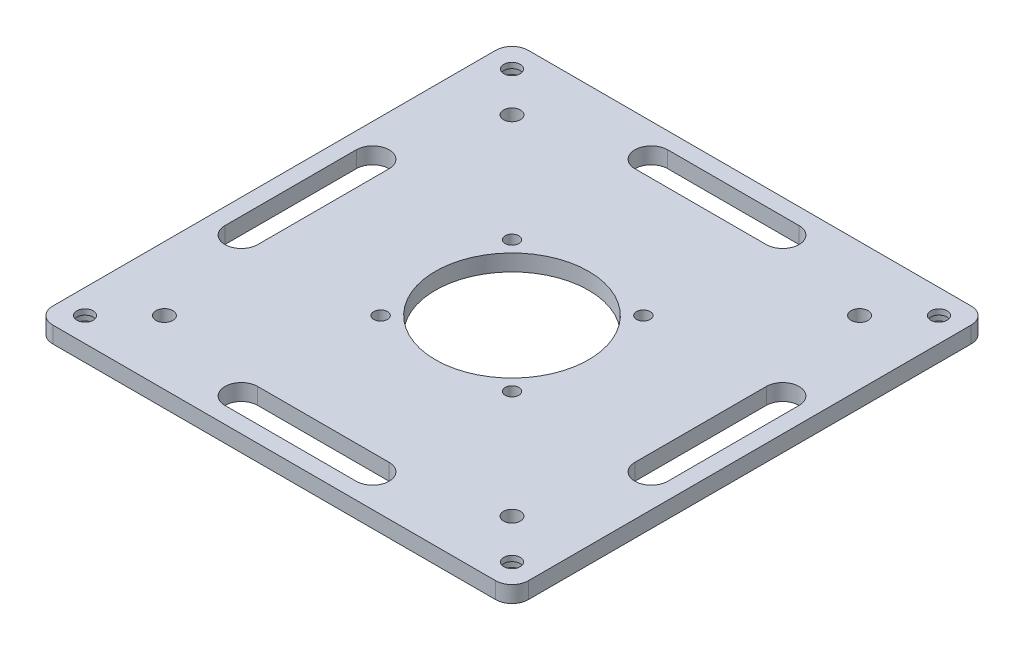
from build123d import *

# Parameters (mm, degrees)
SKETCH_1_W                     = 86.9
SKETCH_1_H                     = 86.9
EXTRUDE_1_DEPTH                = 3
HOLE_WIZARD_M2_5_1_D           = 3
HOLE_WIZARD_M2_5_1_CBORE_D     = 6
HOLE_WIZARD_M2_5_1_CBORE_DEPTH = 2
HOLE_WIZARD_2_0_2_1_D          = 2
HOLE_WIZARD_2_5_2_5_1_D        = 2.5
FILLET_1_R                     = 3
SKETCH_8_R                     = 14
CUT_EXTRUDE_1_DEPTH            = 62.520768851
SKETCH_9_R                     = 1.55
CUT_EXTRUDE_2_DEPTH            = 62.520768851


with BuildPart() as part:
    # 草圖1 → 填料-伸長1 (new body)
    with BuildSketch(Plane(origin=(0, -37, 0), x_dir=(1, 0, 0), z_dir=(0, 1, 0))):
        Rectangle(SKETCH_1_W, SKETCH_1_H)
    extrude(amount=-EXTRUDE_1_DEPTH)

    # M2.5 六角頭機械螺釘的柱孔1 (through all)
    with Locations(Plane(origin=(0, -40, 0), x_dir=(-1, 0, 0), z_dir=(0, -1, 0))):
        with Locations((39, 39), (-39, 39), (-39, -39), (39, -39)):
            CounterBoreHole(HOLE_WIZARD_M2_5_1_D / 2, HOLE_WIZARD_M2_5_1_CBORE_D / 2, HOLE_WIZARD_M2_5_1_CBORE_DEPTH)

    # Ø2.0 (2) 直徑孔1 (through all)
    with Locations(Plane(origin=(0, -37, 0), x_dir=(1, 0, 0), z_dir=(0, 1, 0))):
        with Locations((5, -10), (0, -10), (-5, -10), (-10, -5), (-10, 0), (-10, 5), (-5, 10), (0, 10), (5, 10), (10, 5), (10, 0), (10, -5), (5, -5), (0, -5), (-5, -5), (-5, 0), (-5, 5), (0, 5), (5, 5), (5, 0), (0, 0), (-37.5, 3), (-37.5, 0), (-37.5, -3), (3, 37.5), (0, 37.5), (-3, 37.5), (37.5, -3), (37.5, 0), (37.5, 3), (-3, -37.5), (0, -37.5), (3, -37.5)):
            Hole(HOLE_WIZARD_2_0_2_1_D / 2)

    # Ø2.5 (2.5) 直徑孔1 (through all)
    with Locations(Plane(origin=(0, -40, 0), x_dir=(-1, 0, 0), z_dir=(0, -1, 0))):
        with Locations((12, 12), (-12, 12), (12, -12), (-12, -12)):
            Hole(HOLE_WIZARD_2_5_2_5_1_D / 2)

    # 圓角1
    fillet_1_edges = [part.edges().sort_by_distance(p)[0] for p in [
        (-43.45, -38.5, 43.45),
        (-43.45, -38.5, -43.45),
        (43.45, -38.5, 43.45),
        (43.45, -38.5, -43.45),
    ]]
    fillet(fillet_1_edges, radius=FILLET_1_R)

    # 草圖8 → 除料-伸長1 (cut, through all)
    with BuildSketch(Plane(origin=(0, -37, 0), x_dir=(1, 0, 0), z_dir=(0, 1, 0))):
        Circle(SKETCH_8_R)
        with BuildLine():
            Line((-40.45, -12), (-40.45, 12))
            ThreePointArc((-40.45, 12), (-37.45, 15), (-34.45, 12))
            Line((-34.45, 12), (-34.45, -12))
            ThreePointArc((-34.45, -12), (-37.45, -15), (-40.45, -12))
        make_face()
        with BuildLine():
            Line((-12, 40.45), (12, 40.45))
            ThreePointArc((12, 40.45), (15, 37.45), (12, 34.45))
            Line((12, 34.45), (-12, 34.45))
            ThreePointArc((-12, 34.45), (-15, 37.45), (-12, 40.45))
        make_face()
        with BuildLine():
            Line((40.45, 12), (40.45, -12))
            ThreePointArc((40.45, -12), (37.45, -15), (34.45, -12))
            Line((34.45, -12), (34.45, 12))
            ThreePointArc((34.45, 12), (37.45, 15), (40.45, 12))
        make_face()
        with BuildLine():
            Line((12, -40.45), (-12, -40.45))
            ThreePointArc((-12, -40.45), (-15, -37.45), (-12, -34.45))
            Line((-12, -34.45), (12, -34.45))
            ThreePointArc((12, -34.45), (15, -37.45), (12, -40.45))
        make_face()
    extrude(amount=-CUT_EXTRUDE_1_DEPTH, mode=Mode.SUBTRACT)

    # 草圖9 → 除料-伸長2 (cut, through all)
    with BuildSketch(Plane(origin=(0, -37, 0), x_dir=(1, 0, 0), z_dir=(0, 1, 0))):
        with Locations((-31.75, 31.75)):
            Circle(SKETCH_9_R)
        with Locations((31.75, 31.75)):
            Circle(SKETCH_9_R)
        with Locations((-31.75, -31.75)):
            Circle(SKETCH_9_R)
        with Locations((31.75, -31.75)):
            Circle(SKETCH_9_R)
    extrude(amount=-CUT_EXTRUDE_2_DEPTH, mode=Mode.SUBTRACT)


solid = part.part
